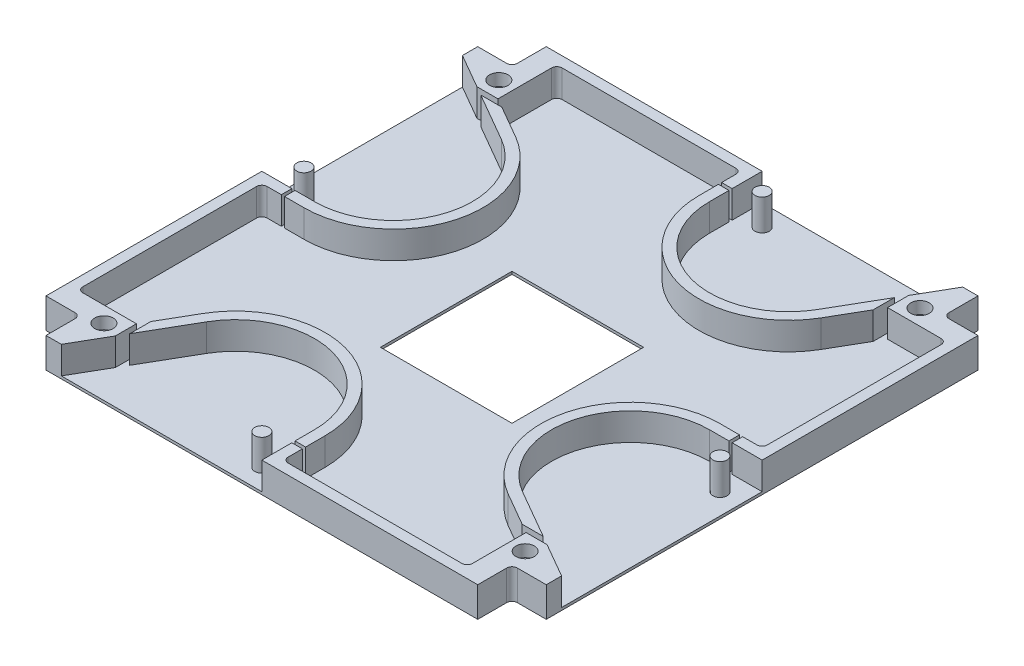
from build123d import *

# Parameters (mm, degrees)
BOSS_EXTRUDE1_DEPTH              = 0.5
BOSS_EXTRUDE2_DEPTH              = 5.2
CIRPATTERN1_COUNT                = 4
SKETCH8_R                        = 1.35
BOSS_EXTRUDE4_DEPTH              = 5.9
CIRPATTERN2_COUNT                = 4
FILLET1_R                        = 1
SKETCH11_W                       = 25
SKETCH11_H                       = 25
CUT_EXTRUDE2_DEPTH               = 126.311013881
SKETCH15_R                       = 0.9
CUT_EXTRUDE3_DEPTH               = 126.301756572
SKETCH16_R                       = 1.75
CUT_EXTRUDE4_DEPTH               = 2.3
CBORE_FOR_M1_6_SHCS2_D           = 1.8
CBORE_FOR_M1_6_SHCS2_CBORE_D     = 3.5
CBORE_FOR_M1_6_SHCS2_CBORE_DEPTH = 1.6
CUT_EXTRUDE5_REACH               = 127.311
SKETCH21_W                       = 2.646406303
SKETCH21_H                       = 0.6
CIRPATTERN4_COUNT                = 4
FILLET2_R                        = 1


with BuildPart() as part:
    # Sketch1 → Boss-Extrude1 (new body)
    with BuildSketch(Plane(origin=(0, 0, 0), x_dir=(1, 0, 0), z_dir=(0, 1, 0))):
        Polygon((0, 0), (0, 6.51), (82, 6.51), (82, 0), (88.51, 0), (88.51, -82), (82, -82), (82, -88.51), (0, -88.51), (0, -82), (-6.51, -82), (-6.51, 0), align=None)
    extrude(amount=BOSS_EXTRUDE1_DEPTH)

    # Sketch2 → Boss-Extrude2 (add)
    with BuildSketch(Plane(origin=(0, 0.5, 0), x_dir=(1, 0, 0), z_dir=(0, 1, 0))):
        with BuildLine():
            Line((41, 6.51), (0, 6.51))
            Line((0, 6.51), (0, 4.51))
            Line((0, 4.51), (39, 4.51))
            Line((39, 4.51), (39, -3.49))
            ThreePointArc((39, -3.49), (51.600076233, -19.910739047), (70.722431864, -11.99))
            Line((70.722431864, -11.99), (73.026059438, -8))
            Line((73.026059438, -8), (74.335460515, -5.732050808))
            Line((74.335460515, -5.732050808), (74.335460515, -1.732050808))
            Line((74.335460515, -1.732050808), (68.990381057, -10.99))
            ThreePointArc((68.990381057, -10.99), (52.117714323, -17.978887394), (41, -3.49))
            Line((41, -3.49), (41, 6.51))
        make_face()
        Polygon((82, 6.51), (79.094010768, 6.51), (75.335460515, 0), (75.335460515, -4), (86.51, -4), (86.51, -41), (88.51, -41), (88.51, 0), (82, 0), align=None)
    boss_extrude2 = extrude(amount=BOSS_EXTRUDE2_DEPTH)

    # CirPattern1: Boss-Extrude2 ×4 about axis
    cirpattern1_axis = Axis((41, -0.325, 41), (0, 1, 0))
    for i in range(1, CIRPATTERN1_COUNT):
        add(boss_extrude2.rotate(cirpattern1_axis, i * 360 / CIRPATTERN1_COUNT))

    # Sketch8 → Boss-Extrude4 (add)
    with BuildSketch(Plane(origin=(0, 0.5, 0), x_dir=(1, 0, 0), z_dir=(0, 1, 0))):
        with Locations((37, -84.51)):
            Circle(SKETCH8_R)
    boss_extrude4 = extrude(amount=BOSS_EXTRUDE4_DEPTH)

    # CirPattern2: Boss-Extrude4 ×4 about axis
    cirpattern2_axis = Axis((41, -0.325, 41), (0, 1, 0))
    for i in range(1, CIRPATTERN2_COUNT):
        add(boss_extrude4.rotate(cirpattern2_axis, i * 360 / CIRPATTERN2_COUNT))

    # Fillet1
    fillet1_edges = [part.edges().sort_by_distance(p)[0] for p in [
        (-4.51, 3.1, 78),
        (-4.51, 3.1, 43),
        (4, 3.1, -4.51),
        (39, 3.1, -4.51),
        (86.51, 3.1, 4),
        (86.51, 3.1, 39),
        (78, 3.1, 86.51),
        (43, 3.1, 86.51),
    ]]
    fillet(fillet1_edges, radius=FILLET1_R)

    # Sketch11 → Cut-Extrude2 (cut, through all)
    with BuildSketch(Plane(origin=(0, 0.5, 0), x_dir=(1, 0, 0), z_dir=(0, 1, 0))):
        with Locations((41, -41)):
            Rectangle(SKETCH11_W, SKETCH11_H)
    extrude(amount=-CUT_EXTRUDE2_DEPTH, mode=Mode.SUBTRACT)

    # Sketch15 → Cut-Extrude3 (cut, through all)
    with BuildSketch(Plane(origin=(0, 5.7, 0), x_dir=(1, 0, 0), z_dir=(0, 1, 0))):
        with Locations((81, -78.5)):
            Circle(SKETCH15_R)
        with Locations((78.5, -1)):
            Circle(SKETCH15_R)
        with Locations((1, -3.5)):
            Circle(SKETCH15_R)
        with Locations((3.5, -81)):
            Circle(SKETCH15_R)
    extrude(amount=-CUT_EXTRUDE3_DEPTH, mode=Mode.SUBTRACT)

    # Sketch16 → Cut-Extrude4 (cut)
    with BuildSketch(Plane(origin=(0, 5.7, 0), x_dir=(1, 0, 0), z_dir=(0, 1, 0))):
        with Locations((78.5, -1)):
            Circle(SKETCH16_R)
        with Locations((81, -78.5)):
            Circle(SKETCH16_R)
        with Locations((3.5, -81)):
            Circle(SKETCH16_R)
        with Locations((1, -3.5)):
            Circle(SKETCH16_R)
    extrude(amount=-CUT_EXTRUDE4_DEPTH, mode=Mode.SUBTRACT)

    # CBORE for M1.6 SHCS2 (through all)
    with Locations(Plane(origin=(81, 0, 78.5), x_dir=(0, 0, -1), z_dir=(0, -1, 0))):
        with Locations((0, 0), (77.5, -2.5), (75, -80), (-2.5, -77.5)):
            CounterBoreHole(CBORE_FOR_M1_6_SHCS2_D / 2, CBORE_FOR_M1_6_SHCS2_CBORE_D / 2, CBORE_FOR_M1_6_SHCS2_CBORE_DEPTH)

    # Sketch21 → Cut-Extrude5 (cut, up to next)
    with BuildSketch(Plane(origin=(0, 0.5, 0), x_dir=(1, 0, 0), z_dir=(0, 1, 0)), mode=Mode.PRIVATE) as cut_extrude5_sk1:
        with Locations((41.909076779, -82.51)):
            Rectangle(SKETCH21_W, SKETCH21_H)
    cut_extrude5_tool1 = extrude(cut_extrude5_sk1.sketch, amount=CUT_EXTRUDE5_REACH, mode=Mode.PRIVATE) & part.part
    cut_extrude5 = cut_extrude5_tool1.solids().sort_by_distance((41.909077, 0.5, 82.51))[0]
    add(cut_extrude5, mode=Mode.SUBTRACT)

    # CirPattern4: Cut-Extrude5 ×4 about axis
    cirpattern4_axis = Axis((41, 6.825, 41), (0, -1, 0))
    for i in range(1, CIRPATTERN4_COUNT):
        add(cut_extrude5.rotate(cirpattern4_axis, i * 360 / CIRPATTERN4_COUNT), mode=Mode.SUBTRACT)

    # Fillet2
    fillet2_edges = [part.edges().sort_by_distance(p)[0] for p in [
        (82, 2.85, 0),
        (82, 2.85, 82),
        (0, 2.85, 82),
        (0, 2.85, 0),
    ]]
    fillet(fillet2_edges, radius=FILLET2_R)


solid = part.part
